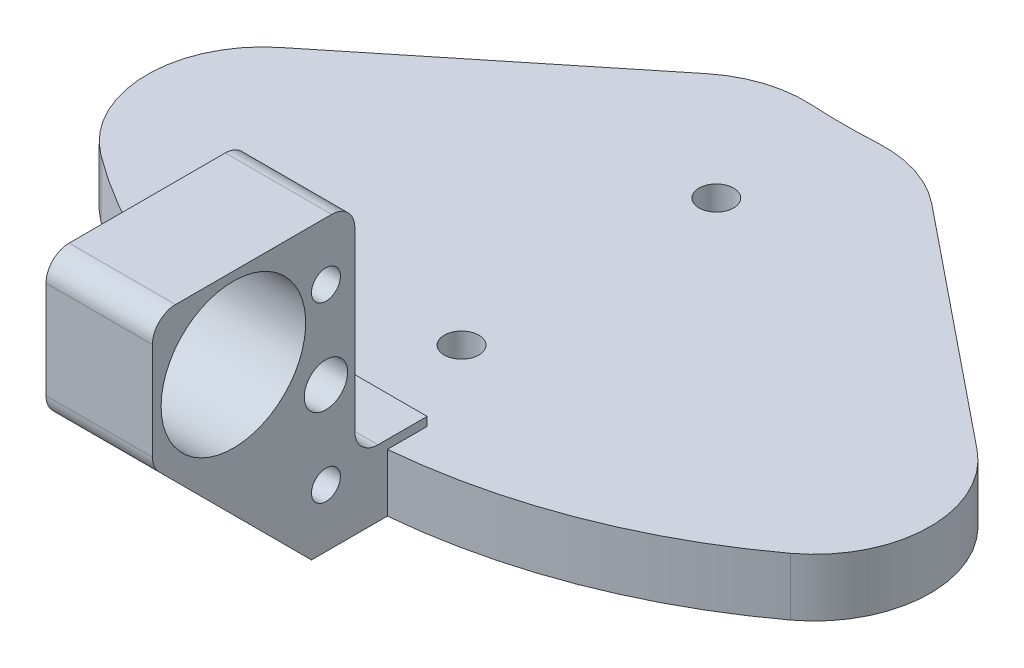
from build123d import *

# Parameters (mm, degrees)
BOSS_EXTRUDE1_DEPTH        = 6.35
BOSS_EXTRUDE2_DEPTH        = 5.842
BOSS_EXTRUDE2_DEPTH_BACK   = 5.842
SKETCH3_R                  = 2.38125
SKETCH3_R_2                = 1.5875
FILLET1_R                  = 12.7
TAP_DRILL_FOR_10_24_TAP3_D = 3.7973
SKETCH6_R                  = 7.9375
CUT_EXTRUDE1_DEPTH         = 107.385112074


with BuildPart() as part:
    # Sketch1 → Boss-Extrude1 (new body)
    with BuildSketch(Plane(origin=(0, 0, 0), x_dir=(1, 0, 0), z_dir=(0, 1, 0))):
        with BuildLine():
            Line((-49.398098352, -39.900850608), (-8.34584372, -6.741276984))
            ThreePointArc((-8.34584372, -6.741276984), (0, -7.292115809), (8.34584372, -6.741276984))
            Line((8.34584372, -6.741276984), (49.398098352, -39.900850608))
            ThreePointArc((49.398098352, -39.900850608), (0, -63.5), (-49.398098352, -39.900850608))
        make_face()
    extrude(amount=BOSS_EXTRUDE1_DEPTH)

    # Sketch3 → Boss-Extrude2 (add, two sides: drawn at the far end of the back side and taken through both)
    with BuildSketch(Plane(origin=(0, 0, 0), x_dir=(0, 0, -1), z_dir=(1, 0, 0)).offset(-BOSS_EXTRUDE2_DEPTH_BACK)):
        with BuildLine():
            Line((-58.8645, 0), (-71.5645, 0))
            Line((-71.5645, 0), (-73.152, 1.5875))
            Line((-73.152, 1.5875), (-88.283051224, 16.718551224))
            ThreePointArc((-88.283051224, 16.718551224), (-88.833654013, 17.54258653), (-89.027, 18.514602448))
            Line((-89.027, 18.514602448), (-89.027, 27.94))
            Line((-89.027, 27.94), (-89.027, 29.21))
            ThreePointArc((-89.027, 29.21), (-88.283051224, 31.006051224), (-86.487, 31.75))
            Line((-86.487, 31.75), (-70.612, 31.75))
            Line((-70.612, 31.75), (-69.342, 31.75))
            ThreePointArc((-69.342, 31.75), (-67.545948776, 31.006051224), (-66.802, 29.21))
            Line((-66.802, 29.21), (-66.802, 15.875))
            Line((-66.802, 15.875), (-66.802, 9.8425))
            ThreePointArc((-66.802, 9.8425), (-66.058051224, 8.046448776), (-64.262, 7.3025))
            Line((-64.262, 7.3025), (-58.8645, 7.3025))
            Line((-58.8645, 7.3025), (-58.8645, 0))
        make_face()
        with Locations((-69.977, 15.875)):
            Circle(SKETCH3_R, mode=Mode.SUBTRACT)
        with Locations((-69.977, 25.4)):
            Circle(SKETCH3_R_2, mode=Mode.SUBTRACT)
        with Locations((-69.977, 6.35)):
            Circle(SKETCH3_R_2, mode=Mode.SUBTRACT)
    extrude(amount=BOSS_EXTRUDE2_DEPTH + BOSS_EXTRUDE2_DEPTH_BACK)

    # Fillet1
    fillet1_edges = [part.edges().sort_by_distance(p)[0] for p in [
        (8.34584372, 3.175, 6.741276984),
        (-8.34584372, 3.175, 6.741276984),
        (-49.398098352, 3.175, 39.900850608),
        (49.398098352, 3.175, 39.900850608),
    ]]
    fillet(fillet1_edges, radius=FILLET1_R)

    # Tap Drill for #10-24 Tap3 (through all)
    with Locations(Plane(origin=(0, 0, 0), x_dir=(-1, 0, 0), z_dir=(0, -1, 0))):
        with Locations((0, -49.24605166), (0, -21.276761093)):
            Hole(TAP_DRILL_FOR_10_24_TAP3_D / 2)

    # Sketch6 → Cut-Extrude1 (cut, through all)
    with BuildSketch(Plane.ZY.offset(5.842)):
        with Locations((80.137, 22.86)):
            Circle(SKETCH6_R)
    extrude(amount=-CUT_EXTRUDE1_DEPTH, mode=Mode.SUBTRACT)


solid = part.part
